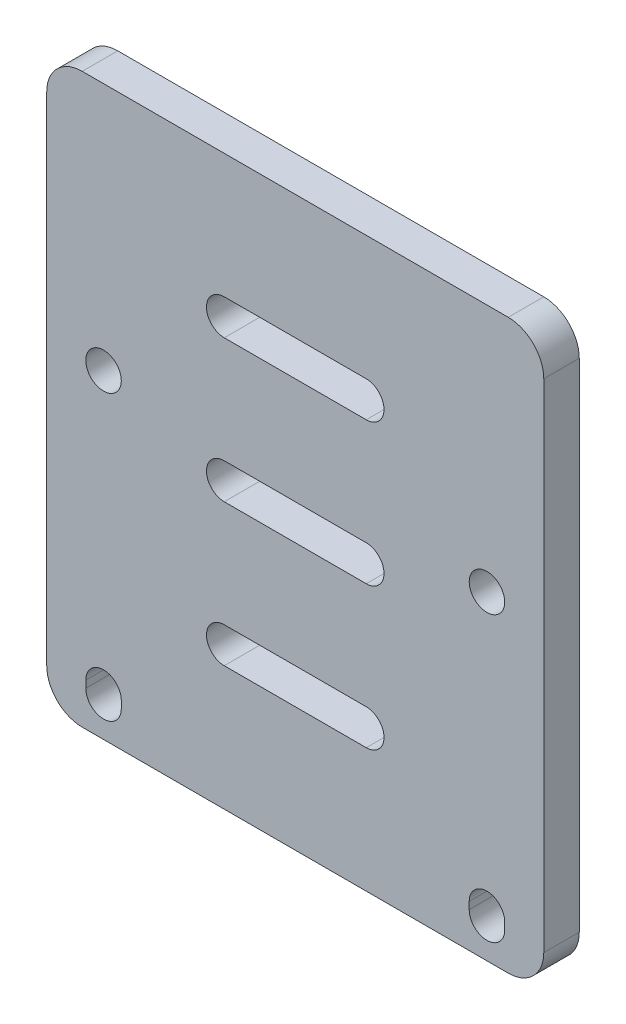
from build123d import *

# Parameters (mm, degrees)
SKETCH4_W           = 70
SKETCH4_H           = 80
SKETCH4_R           = 2.5
BOSS_EXTRUDE2_DEPTH = 5
FILLET1_R           = 5
CUT_EXTRUDE1_DEPTH  = 54.38539126


with BuildPart() as part:
    # Sketch4 → Boss-Extrude2 (new body)
    with BuildSketch(Plane.XY):
        Rectangle(SKETCH4_W, SKETCH4_H)
        with Locations((-27, 5)):
            Circle(SKETCH4_R, mode=Mode.SUBTRACT)
        with Locations((27, 5)):
            Circle(SKETCH4_R, mode=Mode.SUBTRACT)
        with BuildLine():
            Line((-24.5, -34), (-24.5, -35))
            ThreePointArc((-24.5, -35), (-27, -37.5), (-29.5, -35))
            Line((-29.5, -35), (-29.5, -34))
            ThreePointArc((-29.5, -34), (-27, -31.5), (-24.5, -34))
        make_face(mode=Mode.SUBTRACT)
        with BuildLine():
            Line((24.5, -34), (24.5, -35))
            ThreePointArc((24.5, -35), (27, -37.5), (29.5, -35))
            Line((29.5, -35), (29.5, -34))
            ThreePointArc((29.5, -34), (27, -31.5), (24.5, -34))
        make_face(mode=Mode.SUBTRACT)
    extrude(amount=BOSS_EXTRUDE2_DEPTH)

    # Fillet1
    fillet1_edges = [part.edges().sort_by_distance(p)[0] for p in [
        (-35, -40, 2.5),
        (35, -40, 2.5),
        (35, 40, 2.5),
        (-35, 40, 2.5),
    ]]
    fillet(fillet1_edges, radius=FILLET1_R)

    # Sketch6 → Cut-Extrude1 (cut, through all)
    with BuildSketch(Plane.XY.offset(5)):
        with BuildLine():
            Line((-10, 22.5), (10, 22.5))
            ThreePointArc((10, 22.5), (12.5, 20), (10, 17.5))
            Line((10, 17.5), (-10, 17.5))
            ThreePointArc((-10, 17.5), (-12.5, 20), (-10, 22.5))
        make_face()
        with BuildLine():
            Line((-10, 2.5), (10, 2.5))
            ThreePointArc((10, 2.5), (12.5, 0), (10, -2.5))
            Line((10, -2.5), (-10, -2.5))
            ThreePointArc((-10, -2.5), (-12.5, 0), (-10, 2.5))
        make_face()
        with BuildLine():
            Line((-10, -22.5), (10, -22.5))
            ThreePointArc((10, -22.5), (12.5, -20), (10, -17.5))
            Line((10, -17.5), (-10, -17.5))
            ThreePointArc((-10, -17.5), (-12.5, -20), (-10, -22.5))
        make_face()
    extrude(amount=-CUT_EXTRUDE1_DEPTH, mode=Mode.SUBTRACT)


solid = part.part
